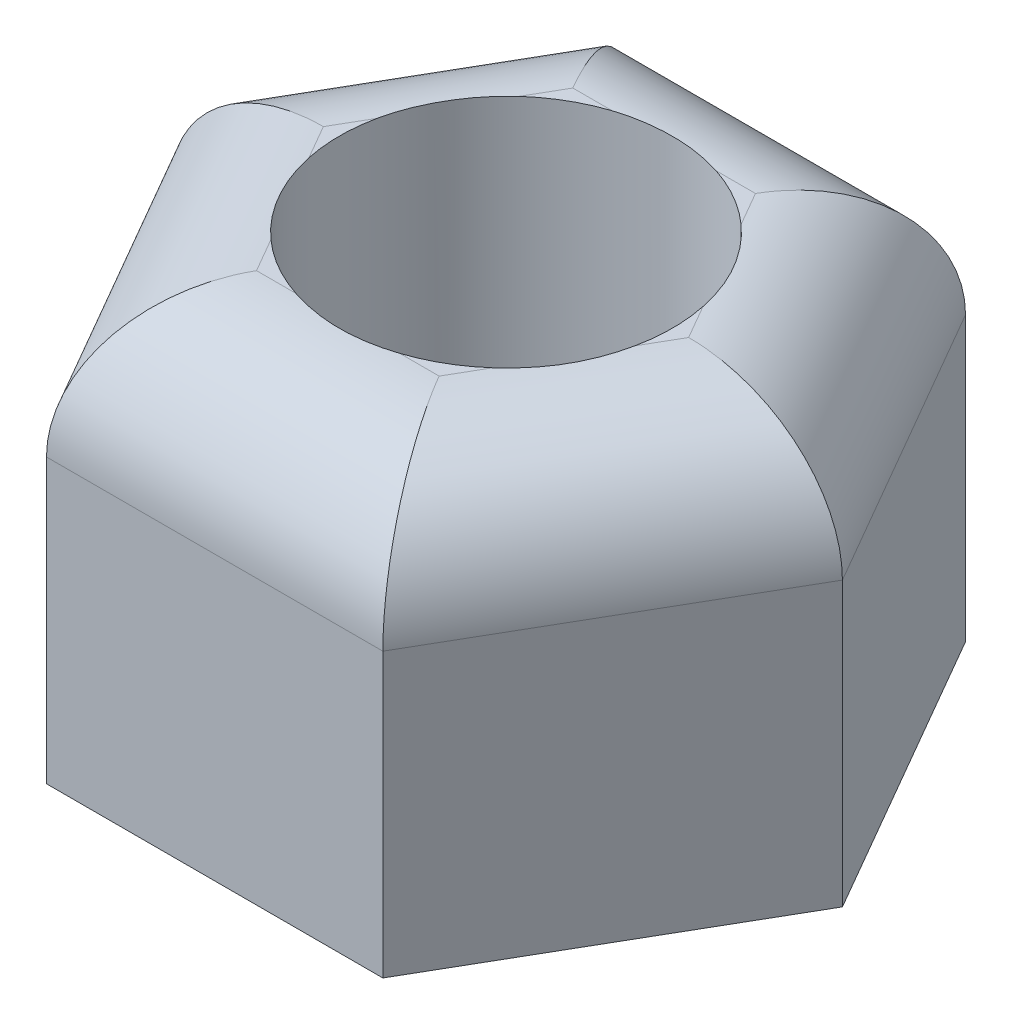
from build123d import *

# Parameters (mm, degrees)
SKETCH1_R           = 3.175
BOSS_EXTRUDE1_DEPTH = 7.9375
FILLET1_R           = 2.54


with BuildPart() as part:
    # Sketch1 → Boss-Extrude1 (new body)
    with BuildSketch(Plane(origin=(0, 0, 0), x_dir=(1, 0, 0), z_dir=(0, 1, 0))):
        Polygon((-6.415804866, 0), (-3.207902433, -5.55625), (3.207902433, -5.55625), (6.415804866, 0), (3.207902433, 5.55625), (-3.207902433, 5.55625), align=None)
        with Locations(Location((0, 0, 0), (0, 0, 270))):
            Circle(SKETCH1_R, mode=Mode.SUBTRACT)
    extrude(amount=BOSS_EXTRUDE1_DEPTH)

    # Fillet1
    # the kernel refuses this fillet: 2.54 mm, written as the material it takes off along each edge
    with BuildSketch(Plane(origin=(-9.557902433, 7.9375, 5.55625), x_dir=(0, -1, 0), z_dir=(1, 0, 0)), Plane(origin=(0.032902433, 7.9375, 11.055511314), x_dir=(0, -1, 0), z_dir=(0.49999999999999967, 0, -0.8660254037844389)), Plane(origin=(9.590804866, 7.9375, 5.499261314), x_dir=(0, -1, 0), z_dir=(-0.5000000000000002, 0, -0.8660254037844386)), Plane(origin=(9.557902433, 7.9375, -5.55625), x_dir=(0, -1, 0), z_dir=(-1, 0, 0)), Plane(origin=(-0.032902433, 7.9375, -11.055511314), x_dir=(0, -1, 0), z_dir=(-0.49999999999999983, 0, 0.8660254037844388)), Plane(origin=(-9.590804866, 7.9375, -5.499261314), x_dir=(0, -1, 0), z_dir=(0.5000000000000001, 0, 0.8660254037844386))) as fillet1_piece_1:
        with BuildLine():
            CenterArc((FILLET1_R, FILLET1_R), FILLET1_R, 180, 90)
            Line((0, FILLET1_R), (0, 0))
            Line((0, 0), (FILLET1_R, 0))
        make_face()
    extrude(amount=19.115804866, mode=Mode.SUBTRACT)


solid = part.part
